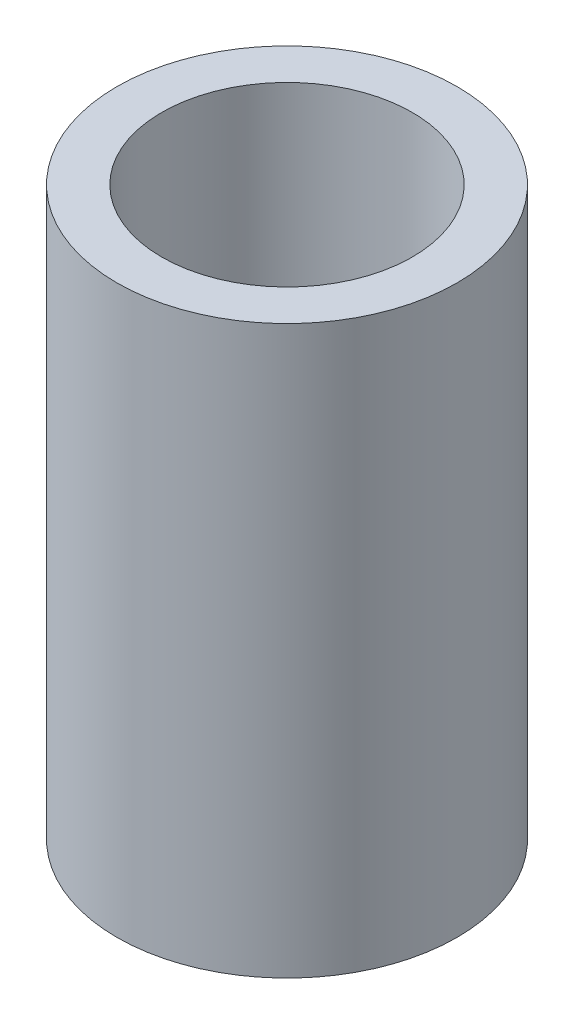
from build123d import *

# Parameters (mm, degrees)
SKETCH1_R           = 2.85
SKETCH1_R_2         = 2.1
BOSS_EXTRUDE1_DEPTH = 9.5


with BuildPart() as part:
    # Sketch1 → Boss-Extrude1 (new body)
    with BuildSketch(Plane(origin=(0, 0, 0), x_dir=(1, 0, 0), z_dir=(0, 1, 0))):
        Circle(SKETCH1_R)
        Circle(SKETCH1_R_2, mode=Mode.SUBTRACT)
    extrude(amount=BOSS_EXTRUDE1_DEPTH)


solid = part.part
